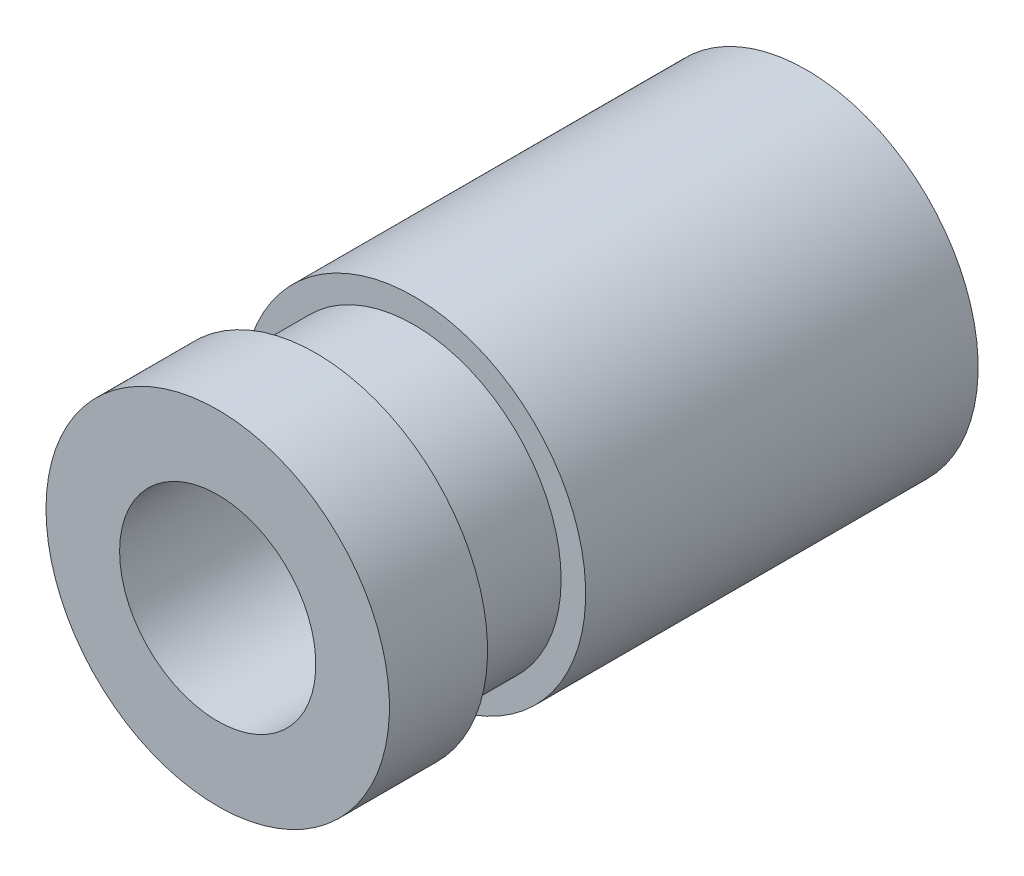
from build123d import *

# Parameters (mm, degrees)
SKETCH1_R           = 2.2225
SKETCH1_R_2         = 1.27
BOSS_EXTRUDE1_DEPTH = 7.62
CUT_EXTRUDE1_START  = -1.27
SKETCH2_R           = 2.2225
SKETCH2_R_2         = 1.905
CUT_EXTRUDE1_DEPTH  = 1.27


with BuildPart() as part:
    # Sketch1 → Boss-Extrude1 (new body)
    with BuildSketch(Plane.XY):
        Circle(SKETCH1_R)
        Circle(SKETCH1_R_2, mode=Mode.SUBTRACT)
    extrude(amount=BOSS_EXTRUDE1_DEPTH)

    # Sketch2 → Cut-Extrude1 (cut)
    with BuildSketch(Plane.XY.offset(6.35).offset(CUT_EXTRUDE1_START)):
        Circle(SKETCH2_R)
        Circle(SKETCH2_R_2, mode=Mode.SUBTRACT)
    extrude(amount=CUT_EXTRUDE1_DEPTH, mode=Mode.SUBTRACT)


solid = part.part
